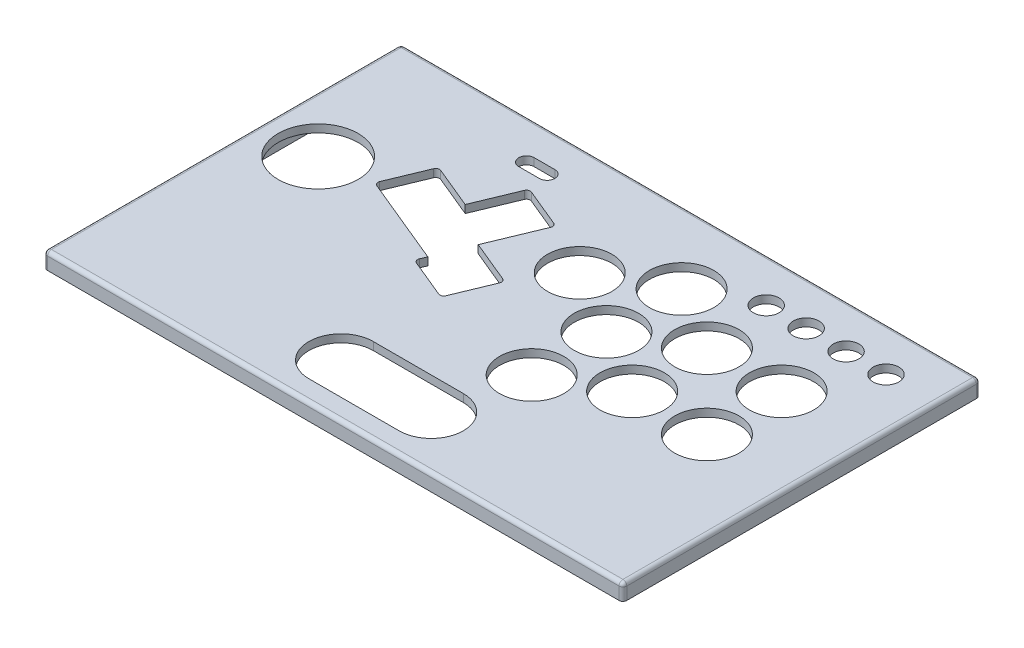
from build123d import *

# Parameters (mm, degrees)
SKETCH2_W                       = 224.807886448
SKETCH2_H                       = 138.699439424
TOP_PLATE_DEPTH                 = 6.35
PRIMARY_BUTTON_CUTOUTS_REACH    = 165.236
BUTTON_CUTOUTS_R                = 12.5
BUTTON_CUTOUTS_R_2              = 15.5
FILLET1_R                       = 1.5
SKETCH4_W                       = 212.807886448
SKETCH4_H                       = 126.699439424
CUT_EXTRUDE2_DEPTH              = 3.3
FILLET2_R                       = 1.5
SKETCH5_W                       = 35
SKETCH5_H                       = 6
CUT_EXTRUDE3_DEPTH              = 3
TAP_DRILL_FOR_M3X0_5_TAP1_D     = 2.5
TAP_DRILL_FOR_M3X0_5_TAP1_DEPTH = 4
TAP_DRILL_FOR_M3X0_5_TAP1_TIP   = 0.751075774
EXTRA_BUTTONS_REACH             = 165.236
SKETCH7_R                       = 5
LED_CUTOUT_REACH                = 165.236


with BuildPart() as part:
    # Sketch2 → top plate (new body)
    with BuildSketch(Plane(origin=(0, 0, 0), x_dir=(1, 0, 0), z_dir=(0, 1, 0))):
        with Locations((0, 48.849719712)):
            Rectangle(SKETCH2_W, SKETCH2_H)
    extrude(amount=TOP_PLATE_DEPTH)

    # Button Cutouts → primary button cutouts (cut, up to next)
    with BuildSketch(Plane(origin=(0, 0, 0), x_dir=(1, 0, 0), z_dir=(0, 1, 0)), mode=Mode.PRIVATE) as primary_button_cutouts_sk1:
        with Locations((24.5, 32)):
            Circle(BUTTON_CUTOUTS_R)
    primary_button_cutouts_tool1 = extrude(primary_button_cutouts_sk1.sketch, amount=PRIMARY_BUTTON_CUTOUTS_REACH, mode=Mode.PRIVATE) & part.part
    # Button Cutouts → primary button cutouts (cut, up to next)
    with BuildSketch(Plane(origin=(0, 0, 0), x_dir=(1, 0, 0), z_dir=(0, 1, 0)), mode=Mode.PRIVATE) as primary_button_cutouts_sk2:
        with Locations((24.5, 61)):
            Circle(BUTTON_CUTOUTS_R)
    primary_button_cutouts_tool2 = extrude(primary_button_cutouts_sk2.sketch, amount=PRIMARY_BUTTON_CUTOUTS_REACH, mode=Mode.PRIVATE) & part.part
    # Button Cutouts → primary button cutouts (cut, up to next)
    with BuildSketch(Plane(origin=(0, 0, 0), x_dir=(1, 0, 0), z_dir=(0, 1, 0)), mode=Mode.PRIVATE) as primary_button_cutouts_sk3:
        with Locations((49.5, 46)):
            Circle(BUTTON_CUTOUTS_R)
    primary_button_cutouts_tool3 = extrude(primary_button_cutouts_sk3.sketch, amount=PRIMARY_BUTTON_CUTOUTS_REACH, mode=Mode.PRIVATE) & part.part
    # Button Cutouts → primary button cutouts (cut, up to next)
    with BuildSketch(Plane(origin=(0, 0, 0), x_dir=(1, 0, 0), z_dir=(0, 1, 0)), mode=Mode.PRIVATE) as primary_button_cutouts_sk4:
        with Locations((49.5, 75)):
            Circle(BUTTON_CUTOUTS_R)
    primary_button_cutouts_tool4 = extrude(primary_button_cutouts_sk4.sketch, amount=PRIMARY_BUTTON_CUTOUTS_REACH, mode=Mode.PRIVATE) & part.part
    # Button Cutouts → primary button cutouts (cut, up to next)
    with BuildSketch(Plane(origin=(0, 0, 0), x_dir=(1, 0, 0), z_dir=(0, 1, 0)), mode=Mode.PRIVATE) as primary_button_cutouts_sk5:
        with Locations((78.5, 75)):
            Circle(BUTTON_CUTOUTS_R)
    primary_button_cutouts_tool5 = extrude(primary_button_cutouts_sk5.sketch, amount=PRIMARY_BUTTON_CUTOUTS_REACH, mode=Mode.PRIVATE) & part.part
    # Button Cutouts → primary button cutouts (cut, up to next)
    with BuildSketch(Plane(origin=(0, 0, 0), x_dir=(1, 0, 0), z_dir=(0, 1, 0)), mode=Mode.PRIVATE) as primary_button_cutouts_sk6:
        with Locations((78.5, 46)):
            Circle(BUTTON_CUTOUTS_R)
    primary_button_cutouts_tool6 = extrude(primary_button_cutouts_sk6.sketch, amount=PRIMARY_BUTTON_CUTOUTS_REACH, mode=Mode.PRIVATE) & part.part
    # Button Cutouts → primary button cutouts (cut, up to next)
    with BuildSketch(Plane(origin=(0, 0, 0), x_dir=(1, 0, 0), z_dir=(0, 1, 0)), mode=Mode.PRIVATE) as primary_button_cutouts_sk7:
        with Locations((-90.403943224, 64.008304483)):
            Circle(BUTTON_CUTOUTS_R_2)
    primary_button_cutouts_tool7 = extrude(primary_button_cutouts_sk7.sketch, amount=PRIMARY_BUTTON_CUTOUTS_REACH, mode=Mode.PRIVATE) & part.part
    # Button Cutouts → primary button cutouts (cut, up to next)
    with BuildSketch(Plane(origin=(0, 0, 0), x_dir=(1, 0, 0), z_dir=(0, 1, 0)), mode=Mode.PRIVATE) as primary_button_cutouts_sk8:
        with Locations((24.680313923, 89.999439424)):
            Circle(BUTTON_CUTOUTS_R)
    primary_button_cutouts_tool8 = extrude(primary_button_cutouts_sk8.sketch, amount=PRIMARY_BUTTON_CUTOUTS_REACH, mode=Mode.PRIVATE) & part.part
    # Button Cutouts → primary button cutouts (cut, up to next)
    with BuildSketch(Plane(origin=(0, 0, 0), x_dir=(1, 0, 0), z_dir=(0, 1, 0)), mode=Mode.PRIVATE) as primary_button_cutouts_sk9:
        with Locations((-0.524094275, 75.65587615)):
            Circle(BUTTON_CUTOUTS_R)
    primary_button_cutouts_tool9 = extrude(primary_button_cutouts_sk9.sketch, amount=PRIMARY_BUTTON_CUTOUTS_REACH, mode=Mode.PRIVATE) & part.part
    # Button Cutouts → primary button cutouts (cut, up to next)
    with BuildSketch(Plane(origin=(0, 0, 0), x_dir=(1, 0, 0), z_dir=(0, 1, 0)), mode=Mode.PRIVATE) as primary_button_cutouts_sk10:
        with BuildLine():
            Line((17.5, -12.5), (-17.5, -12.5))
            ThreePointArc((-17.5, -12.5), (-30, 0), (-17.5, 12.5))
            Line((-17.5, 12.5), (17.5, 12.5))
            ThreePointArc((17.5, 12.5), (30, 0), (17.5, -12.5))
        make_face()
    primary_button_cutouts_tool10 = extrude(primary_button_cutouts_sk10.sketch, amount=PRIMARY_BUTTON_CUTOUTS_REACH, mode=Mode.PRIVATE) & part.part
    # Button Cutouts → primary button cutouts (cut, up to next)
    with BuildSketch(Plane(origin=(0, 0, 0), x_dir=(1, 0, 0), z_dir=(0, 1, 0)), mode=Mode.PRIVATE) as primary_button_cutouts_sk11:
        Polygon((-70.581424626, 66.134393952), (-63.310439411, 83.688105069), (-45.710534316, 76.397985683), (-38.42041493, 93.997890777), (-20.866703812, 86.726905562), (-29.687556928, 65.431482338), (-12.087651834, 58.141362951), (-19.358637049, 40.587651834), (-36.912348166, 47.858637049), (-35.381614437, 51.554155179), align=None)
    primary_button_cutouts_tool11 = extrude(primary_button_cutouts_sk11.sketch, amount=PRIMARY_BUTTON_CUTOUTS_REACH, mode=Mode.PRIVATE) & part.part
    add(primary_button_cutouts_tool1.solids().sort_by_distance((24.5, 0, -32))[0], mode=Mode.SUBTRACT)
    add(primary_button_cutouts_tool2.solids().sort_by_distance((24.5, 0, -61))[0], mode=Mode.SUBTRACT)
    add(primary_button_cutouts_tool3.solids().sort_by_distance((49.5, 0, -46))[0], mode=Mode.SUBTRACT)
    add(primary_button_cutouts_tool4.solids().sort_by_distance((49.5, 0, -75))[0], mode=Mode.SUBTRACT)
    add(primary_button_cutouts_tool5.solids().sort_by_distance((78.5, 0, -75))[0], mode=Mode.SUBTRACT)
    add(primary_button_cutouts_tool6.solids().sort_by_distance((78.5, 0, -46))[0], mode=Mode.SUBTRACT)
    add(primary_button_cutouts_tool7.solids().sort_by_distance((-90.403943, 0, -64.008304))[0], mode=Mode.SUBTRACT)
    add(primary_button_cutouts_tool8.solids().sort_by_distance((24.680314, 0, -89.999439))[0], mode=Mode.SUBTRACT)
    add(primary_button_cutouts_tool9.solids().sort_by_distance((-0.524094, 0, -75.655876))[0], mode=Mode.SUBTRACT)
    add(primary_button_cutouts_tool10.solids().sort_by_distance((0, 0, 0))[0], mode=Mode.SUBTRACT)
    add(primary_button_cutouts_tool11.solids().sort_by_distance((-39.131182, 0, -67.460691))[0], mode=Mode.SUBTRACT)

    # Fillet1
    fillet1_edges = [part.edges().sort_by_distance(p)[0] for p in [
        (-20.866703812, 3.175, -86.726905562),
        (-12.087651834, 3.175, -58.141362951),
        (-19.358637049, 3.175, -40.587651834),
        (-36.912348166, 3.175, -47.858637049),
        (-70.581424626, 3.175, -66.134393952),
        (-63.310439411, 3.175, -83.688105069),
        (-38.42041493, 3.175, -93.997890777),
    ]]
    fillet(fillet1_edges, radius=FILLET1_R)

    # Sketch4 → Cut-Extrude2 (cut)
    with BuildSketch(Plane.XZ):
        with Locations((0, -48.849719712)):
            Rectangle(SKETCH4_W, SKETCH4_H)
    extrude(amount=-CUT_EXTRUDE2_DEPTH, mode=Mode.SUBTRACT)

    # Fillet2
    fillet2_edges = [part.edges().sort_by_distance(p)[0] for p in [
        (112.403943224, 3.175, -118.199439424),
        (-112.403943224, 3.175, -118.199439424),
        (-112.403943224, 3.175, 20.5),
        (112.403943224, 3.175, 20.5),
        (112.403943224, 6.35, -48.849719712),
        (0, 6.35, -118.199439424),
        (0, 6.35, 20.5),
        (-112.403943224, 6.35, -48.849719712),
    ]]
    fillet(fillet2_edges, radius=FILLET2_R)

    # Sketch5 → Cut-Extrude3 (cut)
    with BuildSketch(Plane.XZ):
        with Locations((-73.903943224, -115.199439424)):
            Rectangle(SKETCH5_W, SKETCH5_H)
    extrude(amount=-CUT_EXTRUDE3_DEPTH, mode=Mode.SUBTRACT)

    # Tap Drill for M3x0.5 Tap1
    with Locations(Plane(origin=(-108.403943224, 0, 16.5), x_dir=(0, 0, -1), z_dir=(0, -1, 0))):
        with Locations((0, 0), (130.699439424, 0), (130.699439424, 216.807886448), (0, 216.807886448)):
            Hole(TAP_DRILL_FOR_M3X0_5_TAP1_D / 2, depth=TAP_DRILL_FOR_M3X0_5_TAP1_DEPTH)
            with Locations((0, 0, -(TAP_DRILL_FOR_M3X0_5_TAP1_DEPTH + TAP_DRILL_FOR_M3X0_5_TAP1_TIP / 2))):  # 118° drill point
                Cone(0, TAP_DRILL_FOR_M3X0_5_TAP1_D / 2, TAP_DRILL_FOR_M3X0_5_TAP1_TIP, mode=Mode.SUBTRACT)

    # Sketch7 → extra_buttons (cut, up to next)
    with BuildSketch(Plane(origin=(0, 6.35, 0), x_dir=(1, 0, 0), z_dir=(0, 1, 0)), mode=Mode.PRIVATE) as extra_buttons_sk1:
        with Locations((46.596056776, 100.920000483)):
            Circle(SKETCH7_R)
    extra_buttons_tool1 = extrude(extra_buttons_sk1.sketch, amount=-EXTRA_BUTTONS_REACH, mode=Mode.PRIVATE) & part.part
    # Sketch7 → extra_buttons (cut, up to next)
    with BuildSketch(Plane(origin=(0, 6.35, 0), x_dir=(1, 0, 0), z_dir=(0, 1, 0)), mode=Mode.PRIVATE) as extra_buttons_sk2:
        with Locations((62.096056776, 100.920000483)):
            Circle(SKETCH7_R)
    extra_buttons_tool2 = extrude(extra_buttons_sk2.sketch, amount=-EXTRA_BUTTONS_REACH, mode=Mode.PRIVATE) & part.part
    # Sketch7 → extra_buttons (cut, up to next)
    with BuildSketch(Plane(origin=(0, 6.35, 0), x_dir=(1, 0, 0), z_dir=(0, 1, 0)), mode=Mode.PRIVATE) as extra_buttons_sk3:
        with Locations((77.596056776, 100.920000483)):
            Circle(SKETCH7_R)
    extra_buttons_tool3 = extrude(extra_buttons_sk3.sketch, amount=-EXTRA_BUTTONS_REACH, mode=Mode.PRIVATE) & part.part
    # Sketch7 → extra_buttons (cut, up to next)
    with BuildSketch(Plane(origin=(0, 6.35, 0), x_dir=(1, 0, 0), z_dir=(0, 1, 0)), mode=Mode.PRIVATE) as extra_buttons_sk4:
        with Locations((93.096056776, 100.920000483)):
            Circle(SKETCH7_R)
    extra_buttons_tool4 = extrude(extra_buttons_sk4.sketch, amount=-EXTRA_BUTTONS_REACH, mode=Mode.PRIVATE) & part.part
    add(extra_buttons_tool1.solids().sort_by_distance((46.596057, 6.35, -100.92))[0], mode=Mode.SUBTRACT)
    add(extra_buttons_tool2.solids().sort_by_distance((62.096057, 6.35, -100.92))[0], mode=Mode.SUBTRACT)
    add(extra_buttons_tool3.solids().sort_by_distance((77.596057, 6.35, -100.92))[0], mode=Mode.SUBTRACT)
    add(extra_buttons_tool4.solids().sort_by_distance((93.096057, 6.35, -100.92))[0], mode=Mode.SUBTRACT)

    # Sketch8 → led_cutout (cut, up to next)
    with BuildSketch(Plane(origin=(0, 6.35, 0), x_dir=(1, 0, 0), z_dir=(0, 1, 0)), mode=Mode.PRIVATE) as led_cutout_sk1:
        with BuildLine():
            Line((-48.062495753, 105.533619334), (-40.062495753, 105.533619334))
            ThreePointArc((-40.062495753, 105.533619334), (-37.062495753, 102.533619334), (-40.062495753, 99.533619334))
            Line((-40.062495753, 99.533619334), (-48.062495753, 99.533619334))
            ThreePointArc((-48.062495753, 99.533619334), (-51.062495753, 102.533619334), (-48.062495753, 105.533619334))
        make_face()
    led_cutout_tool1 = extrude(led_cutout_sk1.sketch, amount=-LED_CUTOUT_REACH, mode=Mode.PRIVATE) & part.part
    add(led_cutout_tool1.solids().sort_by_distance((-44.062496, 6.35, -102.533619))[0], mode=Mode.SUBTRACT)


solid = part.part
